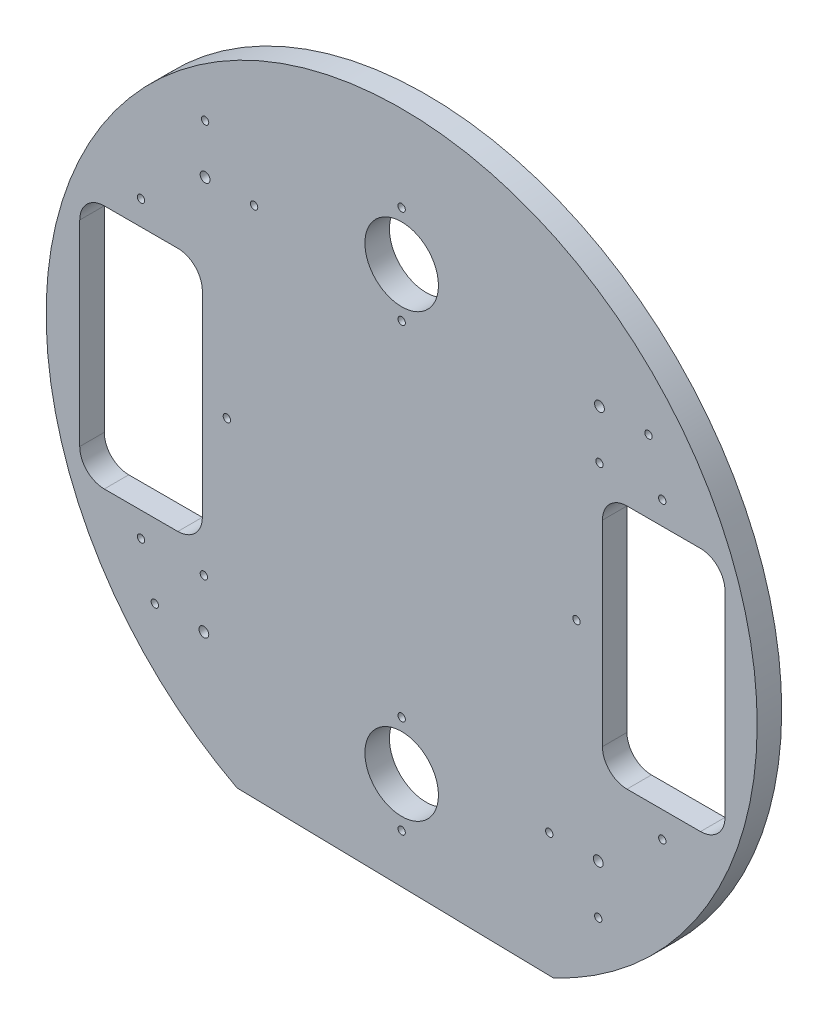
from build123d import *

# Parameters (mm, degrees)
SKETCH1_R           = 1.5
SKETCH1_R_2         = 2
SKETCH1_R_3         = 15
BOSS_EXTRUDE1_DEPTH = 10


with BuildPart() as part:
    # Sketch1 → Boss-Extrude1 (new body)
    with BuildSketch(Plane.XY):
        with BuildLine():
            ThreePointArc((61.887658592, -131.129393021), (2.915418412, 144.970687849), (-67.109617354, -128.5352063))
            Line((-67.109617354, -128.5352063), (61.887658592, -131.129393021))
        make_face()
        with Locations((-100.663133332, -80.169939346)):
            Circle(SKETCH1_R, mode=Mode.SUBTRACT)
        with Locations((-80.669151728, -80.169939346)):
            Circle(SKETCH1_R_2, mode=Mode.SUBTRACT)
        with Locations((-106.289702106, -60)):
            Circle(SKETCH1_R, mode=Mode.SUBTRACT)
        with Locations((-80.669151728, -60.1847491)):
            Circle(SKETCH1_R, mode=Mode.SUBTRACT)
        with BuildLine():
            ThreePointArc((-81.289702106, -40), (-84.218634294, -47.071067812), (-91.289702106, -50))
            Line((-91.289702106, -50), (-121.289702106, -50))
            ThreePointArc((-121.289702106, -50), (-128.360769918, -47.071067812), (-131.289702106, -40))
            Line((-131.289702106, -40), (-131.289702106, 40))
            ThreePointArc((-131.289702106, 40), (-128.360769918, 47.071067812), (-121.289702106, 50))
            Line((-121.289702106, 50), (-91.289702106, 50))
            ThreePointArc((-91.289702106, 50), (-84.218634294, 47.071067812), (-81.289702106, 40))
            Line((-81.289702106, 40), (-81.289702106, -40))
        make_face(mode=Mode.SUBTRACT)
        with Locations((-71.289702106, 0)):
            Circle(SKETCH1_R, mode=Mode.SUBTRACT)
        with Locations((0, -110)):
            Circle(SKETCH1_R, mode=Mode.SUBTRACT)
        with Locations((0, -90)):
            Circle(SKETCH1_R_3, mode=Mode.SUBTRACT)
        with Locations((0, -70)):
            Circle(SKETCH1_R, mode=Mode.SUBTRACT)
        with Locations((60.1847491, -80.669151728)):
            Circle(SKETCH1_R, mode=Mode.SUBTRACT)
        with Locations((80.169939346, -100.663133332)):
            Circle(SKETCH1_R, mode=Mode.SUBTRACT)
        with Locations((80.169939346, -80.669151728)):
            Circle(SKETCH1_R_2, mode=Mode.SUBTRACT)
        with Locations((71.289702106, 0)):
            Circle(SKETCH1_R, mode=Mode.SUBTRACT)
        with Locations((106.289702106, -60)):
            Circle(SKETCH1_R, mode=Mode.SUBTRACT)
        with BuildLine():
            ThreePointArc((81.875824315, 40.586122209), (84.804756503, 47.657190021), (91.875824315, 50.586122209))
            Line((91.875824315, 50.586122209), (121.875824315, 50.586122209))
            ThreePointArc((121.875824315, 50.586122209), (128.946892127, 47.657190021), (131.875824315, 40.586122209))
            Line((131.875824315, 40.586122209), (131.875824315, -39.413877791))
            ThreePointArc((131.875824315, -39.413877791), (128.946892127, -46.484945603), (121.875824315, -49.413877791))
            Line((121.875824315, -49.413877791), (91.875824315, -49.413877791))
            ThreePointArc((91.875824315, -49.413877791), (84.804756503, -46.484945603), (81.875824315, -39.413877791))
            Line((81.875824315, -39.413877791), (81.875824315, 40.586122209))
        make_face(mode=Mode.SUBTRACT)
        with Locations((-106.289702106, 60)):
            Circle(SKETCH1_R, mode=Mode.SUBTRACT)
        with Locations((-80.169939346, 80.669151728)):
            Circle(SKETCH1_R_2, mode=Mode.SUBTRACT)
        with Locations((-80.169939346, 100.663133332)):
            Circle(SKETCH1_R, mode=Mode.SUBTRACT)
        with Locations((-60.1847491, 80.669151728)):
            Circle(SKETCH1_R, mode=Mode.SUBTRACT)
        with Locations((0, 70)):
            Circle(SKETCH1_R, mode=Mode.SUBTRACT)
        with Locations((80.669151728, 60.1847491)):
            Circle(SKETCH1_R, mode=Mode.SUBTRACT)
        with Locations((106.289702106, 60)):
            Circle(SKETCH1_R, mode=Mode.SUBTRACT)
        with Locations((0, 90)):
            Circle(SKETCH1_R_3, mode=Mode.SUBTRACT)
        with Locations((0, 110)):
            Circle(SKETCH1_R, mode=Mode.SUBTRACT)
        with Locations((80.669151728, 80.169939346)):
            Circle(SKETCH1_R_2, mode=Mode.SUBTRACT)
        with Locations((100.663133332, 80.169939346)):
            Circle(SKETCH1_R, mode=Mode.SUBTRACT)
    extrude(amount=BOSS_EXTRUDE1_DEPTH)


solid = part.part
